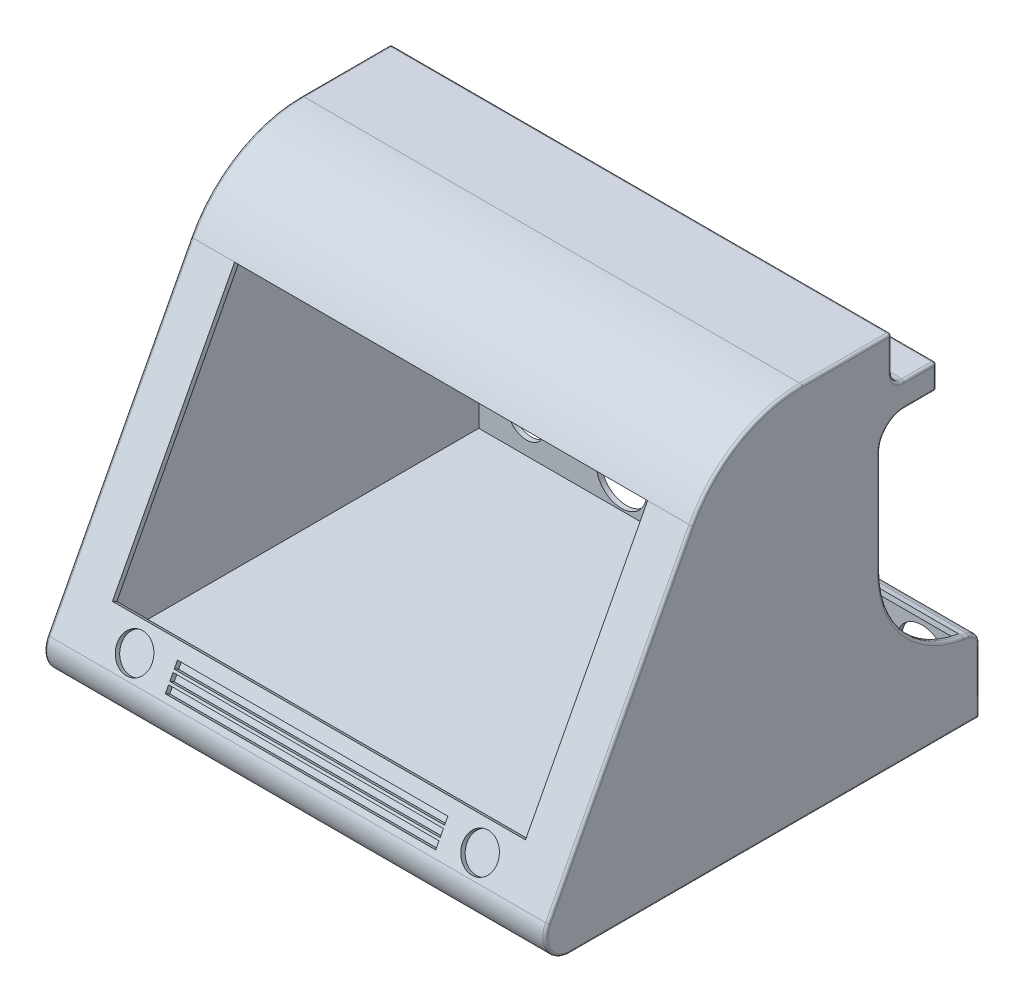
from build123d import *

# Parameters (mm, degrees)
BOSS_EXTRUDE1_DEPTH = 200
FILLET1_R           = 50
FILLET2_R           = 10
FILLET3_R           = 40
FILLET4_R           = 5
FILLET5_R           = 5
FILLET6_R           = 1
FILLET7_R           = 1
FILLET8_R           = 1
FILLET10_R          = 10
SHELL3_START        = 2
SHELL3_DEPTH        = 196
FILLET14_R          = 1
FILLET15_R          = 1
SKETCH5_W           = 165
SKETCH5_H           = 105
CUT_EXTRUDE1_DEPTH  = 20
SKETCH6_W           = 10
SKETCH6_H           = 3
CUT_EXTRUDE4_DEPTH  = 23
SKETCH8_R           = 7
CUT_EXTRUDE6_DEPTH  = 10
SKETCH9_R           = 10
SKETCH9_R_2         = 7.5
CUT_EXTRUDE7_DEPTH  = 3
SKETCH10_W          = 108
SKETCH10_H          = 2.810580917
SKETCH10_H_2        = 2.810580918
CUT_EXTRUDE8_DEPTH  = 3


# Read off the part's stored shape, not the designer's step: Shell3
with BuildPart() as part:
    # Sketch3 → Boss-Extrude1 (new body)
    with BuildSketch(Plane(origin=(0, 0, 0), x_dir=(0, 0, -1), z_dir=(1, 0, 0))):
        Polygon((-61.287916817, 93.76136528), (-140.28529736, -56.769076383), (39.71470264, -56.769076383), (39.71470264, -26.769076383), (0, -20.093366582), (0, 64.906633418), (22.555153974, 64.906633418), (22.555153974, 74.906633418), (4.646904738, 74.906633418), (4.646904738, 93.76136528), align=None)
    extrude(amount=BOSS_EXTRUDE1_DEPTH)

    # Fillet1
    fillet1_edges = [part.edges().sort_by_distance(p)[0] for p in [
        (100, 93.76136528, 61.287916817),
    ]]
    fillet(fillet1_edges, radius=FILLET1_R)

    # Fillet2
    fillet2_edges = [part.edges().sort_by_distance(p)[0] for p in [
        (100, -56.769076383, 140.28529736),
    ]]
    fillet(fillet2_edges, radius=FILLET2_R)

    # Fillet3
    fillet3_edges = [part.edges().sort_by_distance(p)[0] for p in [
        (100, -20.093366582, 0),
    ]]
    fillet(fillet3_edges, radius=FILLET3_R)

    # Fillet4
    fillet4_edges = [part.edges().sort_by_distance(p)[0] for p in [
        (100, -26.769076383, -39.71470264),
    ]]
    fillet(fillet4_edges, radius=FILLET4_R)

    # Fillet5
    fillet5_edges = [part.edges().sort_by_distance(p)[0] for p in [
        (100, 74.906633418, -4.646904738),
    ]]
    fillet(fillet5_edges, radius=FILLET5_R)

    # Fillet6
    fillet6_edges = [part.edges().sort_by_distance(p)[0] for p in [
        (100, 93.76136528, -4.646904738),
    ]]
    fillet(fillet6_edges, radius=FILLET6_R)

    # Fillet7
    fillet7_edges = [part.edges().sort_by_distance(p)[0] for p in [
        (100, 74.906633418, -22.555153974),
    ]]
    fillet(fillet7_edges, radius=FILLET7_R)

    # Fillet8
    fillet8_edges = [part.edges().sort_by_distance(p)[0] for p in [
        (100, 64.906633418, -22.555153974),
    ]]
    fillet(fillet8_edges, radius=FILLET8_R)

    # Fillet10
    fillet10_edges = [part.edges().sort_by_distance(p)[0] for p in [
        (100, 64.906633418, 0),
    ]]
    fillet(fillet10_edges, radius=FILLET10_R)

    # Shell3 outline → Shell3 (cut)
    with BuildSketch(Plane.YZ.offset(SHELL3_START)):
        with BuildLine():
            Line((-27.674806697, -33.037823142), (-25.702476507, -33.369355374))
            ThreePointArc((-25.702476507, -33.369355374), (-12.089709184, -9.461288624), (13.744127299, 0))
            Line((13.744127299, 0), (54.906633418, 0))
            Line((54.906633418, 0), (54.906633418, 2))
            ThreePointArc((54.906633418, 2), (63.391914792, -1.514718626), (66.906633418, -10))
            Line((66.906633418, -10), (66.906633418, -20.555153974))
            Line((66.906633418, -20.555153974), (72.906633418, -20.555153974))
            Line((72.906633418, -20.555153974), (72.906633418, -9.646904738))
            ThreePointArc((72.906633418, -9.646904738), (74.956885949, -4.697157269), (79.906633418, -2.646904738))
            Line((79.906633418, -2.646904738), (91.76136528, -2.646904738))
            Line((91.76136528, -2.646904738), (91.76136528, 31.060602511))
            ThreePointArc((91.76136528, 31.060602511), (84.838407844, 55.893576038), (66.066508022, 73.563315451))
            Line((66.066508022, 73.563315451), (-43.051552593, 130.82775222))
            ThreePointArc((-43.051552593, 130.82775222), (-50.907905305, 130.590140491), (-54.769076383, 123.74396673))
            Line((-54.769076383, 123.74396673), (-54.769076383, -37.71470264))
            Line((-54.769076383, -37.71470264), (-30.998763119, -37.71470264))
            ThreePointArc((-30.998763119, -37.71470264), (-29.061225382, -37.005105993), (-28.040267833, -35.212000987))
            Line((-28.040267833, -35.212000987), (-27.674806697, -33.037823142))
        make_face()
    extrude(amount=SHELL3_DEPTH, mode=Mode.SUBTRACT)

    # Fillet14
    fillet14_edges = [part.edges().sort_by_distance(p)[0] for p in [
        (200, -43.883919751, -39.71470264),
        (200, 12.436858662, 103.966480208),
        (200, 86.549951284, 56.928283268),
        (200, -56.769076383, 42.014632045),
        (200, -51.942612535, 132.301683931),
        (200, 34.325380359, 0),
        (200, -12.089709184, -9.461288624),
        (200, -25.885207075, -34.456444296),
        (200, -27.769533558, -38.532041562),
        (200, 86.333999349, -4.646904738),
        (200, 76.371099512, -6.111370832),
        (200, 93.76136528, 13.706848886),
        (200, 93.468472061, -4.354011519),
        (200, 74.906633418, -15.601029356),
        (200, 74.613740199, -22.262260756),
        (200, 69.906633418, -22.555153974),
        (200, 65.199526636, -22.262260756),
        (200, 64.906633418, -15.777576987),
        (200, 61.97770123, -2.928932188),
    ]]
    fillet(fillet14_edges, radius=FILLET14_R)

    # Fillet15
    fillet15_edges = [part.edges().sort_by_distance(p)[0] for p in [
        (0, -43.883919751, -39.71470264),
        (0, 12.436858662, 103.966480208),
        (0, 86.549951284, 56.928283268),
        (0, -56.769076383, 42.014632045),
        (0, -51.942612535, 132.301683931),
        (0, 34.325380359, 0),
        (0, -12.089709184, -9.461288624),
        (0, -25.885207075, -34.456444296),
        (0, -27.769533558, -38.532041562),
        (0, 86.333999349, -4.646904738),
        (0, 76.371099512, -6.111370832),
        (0, 93.76136528, 13.706848886),
        (0, 93.468472061, -4.354011519),
        (0, 74.906633418, -15.601029356),
        (0, 74.613740199, -22.262260756),
        (0, 69.906633418, -22.555153974),
        (0, 65.199526636, -22.262260756),
        (0, 64.906633418, -15.777576987),
        (0, 61.97770123, -2.928932188),
    ]]
    fillet(fillet15_edges, radius=FILLET15_R)

    # Sketch5 → Cut-Extrude1 (cut)
    with BuildSketch(Plane(origin=(0, 45.46476773, 86.633651895), x_dir=(1, 0, 0), z_dir=(0, 0.4646904737791423, 0.8854731862563182))):
        with Locations((100, -28.184050547)):
            Rectangle(SKETCH5_W, SKETCH5_H)
    extrude(amount=-CUT_EXTRUDE1_DEPTH, mode=Mode.SUBTRACT)

    # Sketch6 → Cut-Extrude4 (cut)
    with BuildSketch(Plane(origin=(0, 74.906633418, 0), x_dir=(1, 0, 0), z_dir=(0, 1, 0))):
        with Locations((179, 17.055153974)):
            Rectangle(SKETCH6_W, SKETCH6_H)
        with Locations((139, 17.055153974)):
            Rectangle(SKETCH6_W, SKETCH6_H)
        with Locations((99, 17.055153974)):
            Rectangle(SKETCH6_W, SKETCH6_H)
        with Locations((59, 17.055153974)):
            Rectangle(SKETCH6_W, SKETCH6_H)
        with Locations((19, 17.021146207)):
            Rectangle(SKETCH6_W, SKETCH6_H)
    extrude(amount=-CUT_EXTRUDE4_DEPTH, mode=Mode.SUBTRACT)

    # Sketch8 → Cut-Extrude6 (cut)
    with BuildSketch(Plane(origin=(0, 45.46476773, 86.633651895), x_dir=(1, 0, 0), z_dir=(0, 0.4646904737791423, 0.8854731862563182))):
        with Locations(Location((31, -90.684050547, 0), (0, 0, 270))):
            Circle(SKETCH8_R)
        with Locations(Location((169, -90.684050547, 0), (0, 0, 270))):
            Circle(SKETCH8_R)
    extrude(amount=-CUT_EXTRUDE6_DEPTH, mode=Mode.SUBTRACT)

    # Sketch9 → Cut-Extrude7 (cut)
    with BuildSketch(Plane(origin=(0, 0, -39.71470264), x_dir=(-1, 0, 0), z_dir=(0, 0, -1))):
        with Locations(Location((-179, -44.269076383, 0), (0, 0, 90))):
            Circle(SKETCH9_R)
        with Locations(Location((-149, -44.039846818, 0), (0, 0, 90))):
            Circle(SKETCH9_R)
        with Locations(Location((-119, -44.039846818, 0), (0, 0, 90))):
            Circle(SKETCH9_R)
        with Locations(Location((-89, -43.960489904, 0), (0, 0, 90))):
            Circle(SKETCH9_R)
        with Locations(Location((-59, -43.960489904, 0), (0, 0, 90))):
            Circle(SKETCH9_R)
        with Locations(Location((-21, -41.769076383, 0), (0, 0, 90))):
            Circle(SKETCH9_R_2)
    extrude(amount=-CUT_EXTRUDE7_DEPTH, mode=Mode.SUBTRACT)

    # Sketch10 → Cut-Extrude8 (cut)
    with BuildSketch(Plane(origin=(0, 45.46476773, 86.633651895), x_dir=(1, 0, 0), z_dir=(0, 0.46469047377914224, 0.8854731862563181))):
        with Locations((100, -87.49160573)):
            Rectangle(SKETCH10_W, SKETCH10_H)
        with Locations((100, -91.302186647)):
            Rectangle(SKETCH10_W, SKETCH10_H_2)
        with Locations((100, -95.112767565)):
            Rectangle(SKETCH10_W, SKETCH10_H_2)
    extrude(amount=-CUT_EXTRUDE8_DEPTH, mode=Mode.SUBTRACT)


solid = part.part
